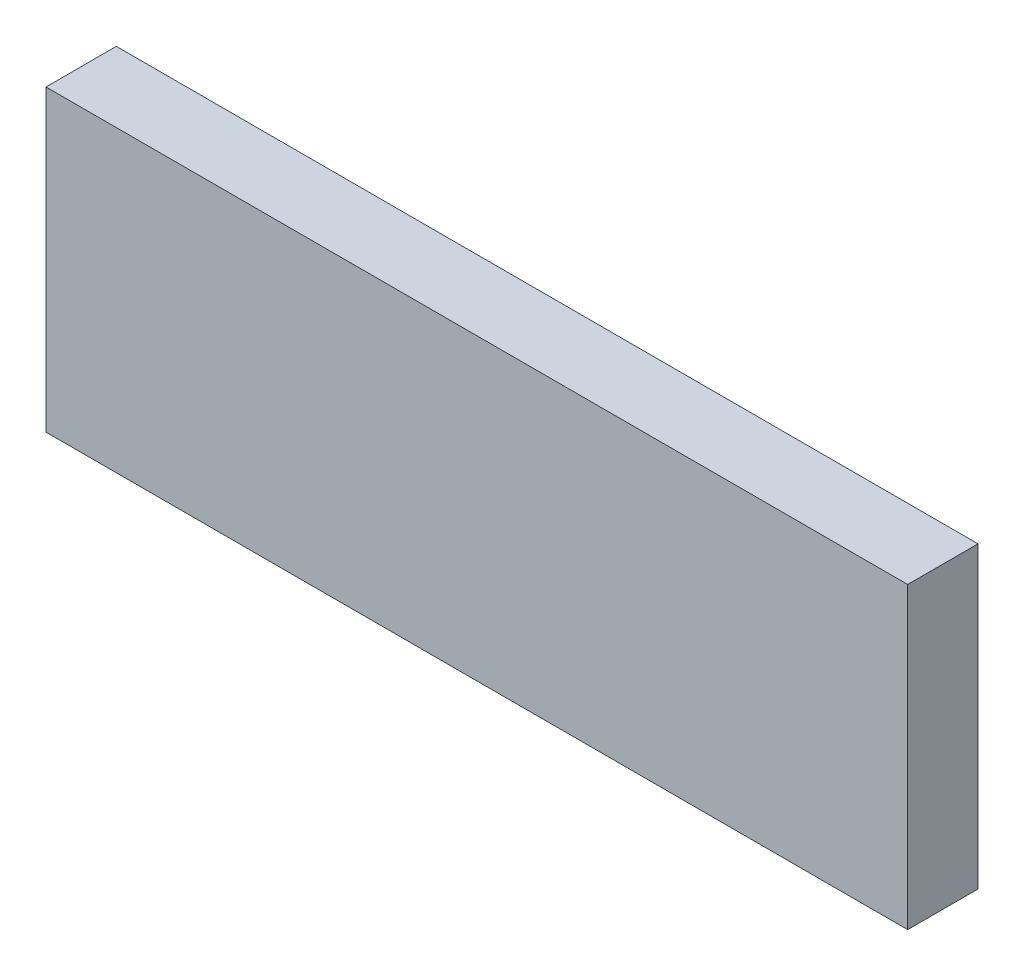
from build123d import *

# Parameters (mm, degrees)
SKETCH1_W           = 311.15
SKETCH1_H           = 25.4
BOSS_EXTRUDE1_DEPTH = 53.975


with BuildPart() as part:
    # Sketch1 → Boss-Extrude1 (new, symmetric)
    with BuildSketch(Plane(origin=(0, 0, 0), x_dir=(1, 0, 0), z_dir=(0, 1, 0))):
        Rectangle(SKETCH1_W, SKETCH1_H)
    extrude(amount=BOSS_EXTRUDE1_DEPTH, both=True)


solid = part.part
